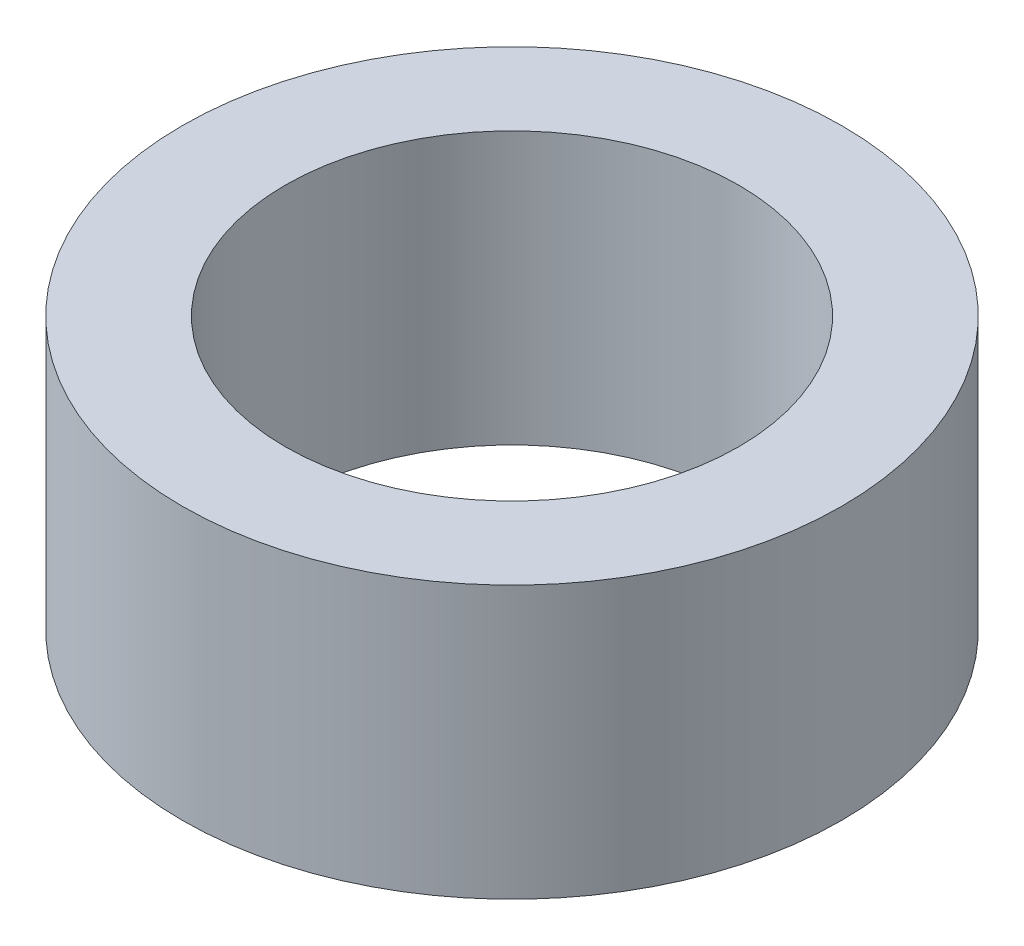
from build123d import *

# Parameters (mm, degrees)
SKETCH2_R           = 11.5443
SKETCH2_R_2         = 7.9375
BOSS_EXTRUDE1_DEPTH = 4.7625


with BuildPart() as part:
    # Sketch2 → Boss-Extrude1 (new, symmetric)
    with BuildSketch(Plane(origin=(0, 0, 0), x_dir=(1, 0, 0), z_dir=(0, 1, 0))):
        Circle(SKETCH2_R)
        Circle(SKETCH2_R_2, mode=Mode.SUBTRACT)
    extrude(amount=BOSS_EXTRUDE1_DEPTH, both=True)


solid = part.part
